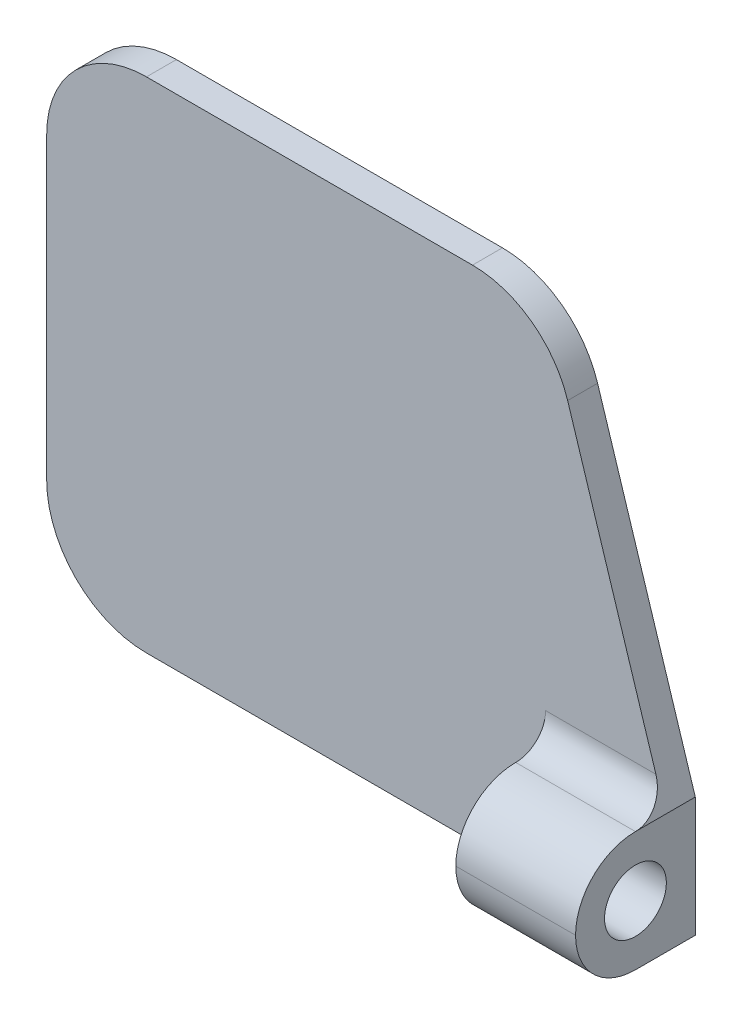
from build123d import *

# Parameters (mm, degrees)
ESQUISSE1_W             = 50
ESQUISSE1_H             = 50
BOSS_EXTRU_1_DEPTH      = 3
BOSS_EXTRU_2_DEPTH      = 3
ESQUISSE3_W             = 12
ESQUISSE3_H             = 12
BOSS_EXTRU_3_DEPTH      = 9
ESQUISSE4_R             = 3.1
ENL_V_MAT_EXTRU_1_DEPTH = 10
CONG_1_R                = 6
CONG_2_R                = 3
CONG_3_R                = 10


with BuildPart() as part:
    # Esquisse1 → Boss.-Extru.1 (new body)
    with BuildSketch(Plane.XY):
        with Locations((25, 25)):
            Rectangle(ESQUISSE1_W, ESQUISSE1_H)
    extrude(amount=BOSS_EXTRU_1_DEPTH)

    # Esquisse2 → Boss.-Extru.2 (add)
    with BuildSketch(Plane.XY.offset(3)):
        Polygon((50, 0), (62, 0), (62, 12), (50, 50), align=None)
    extrude(amount=-BOSS_EXTRU_2_DEPTH)

    # Esquisse3 → Boss.-Extru.3 (add)
    with BuildSketch(Plane.XY.offset(3)):
        with Locations((56, 6)):
            Rectangle(ESQUISSE3_W, ESQUISSE3_H)
    extrude(amount=BOSS_EXTRU_3_DEPTH)

    # Esquisse4 → Enlèv. mat.-Extru.1 (cut)
    with BuildSketch(Plane(origin=(62, 0, 0), x_dir=(0, 0, -1), z_dir=(1, 0, 0))):
        with Locations((-6, 6)):
            Circle(ESQUISSE4_R)
    extrude(amount=-ENL_V_MAT_EXTRU_1_DEPTH, mode=Mode.SUBTRACT)

    # Congé1
    cong_1_edges = [part.edges().sort_by_distance(p)[0] for p in [
        (56, 0, 12),
        (56, 12, 12),
    ]]
    fillet(cong_1_edges, radius=CONG_1_R - 0.0001)  # a hair under: the kernel refuses the full size

    # Congé2
    cong_2_edges = [part.edges().sort_by_distance(p)[0] for p in [
        (56, 12, 3),
    ]]
    fillet(cong_2_edges, radius=CONG_2_R)

    # Congé3
    cong_3_edges = [part.edges().sort_by_distance(p)[0] for p in [
        (0, 0, 1.5),
        (0, 50, 1.5),
        (50, 50, 1.5),
    ]]
    fillet(cong_3_edges, radius=CONG_3_R)


solid = part.part
